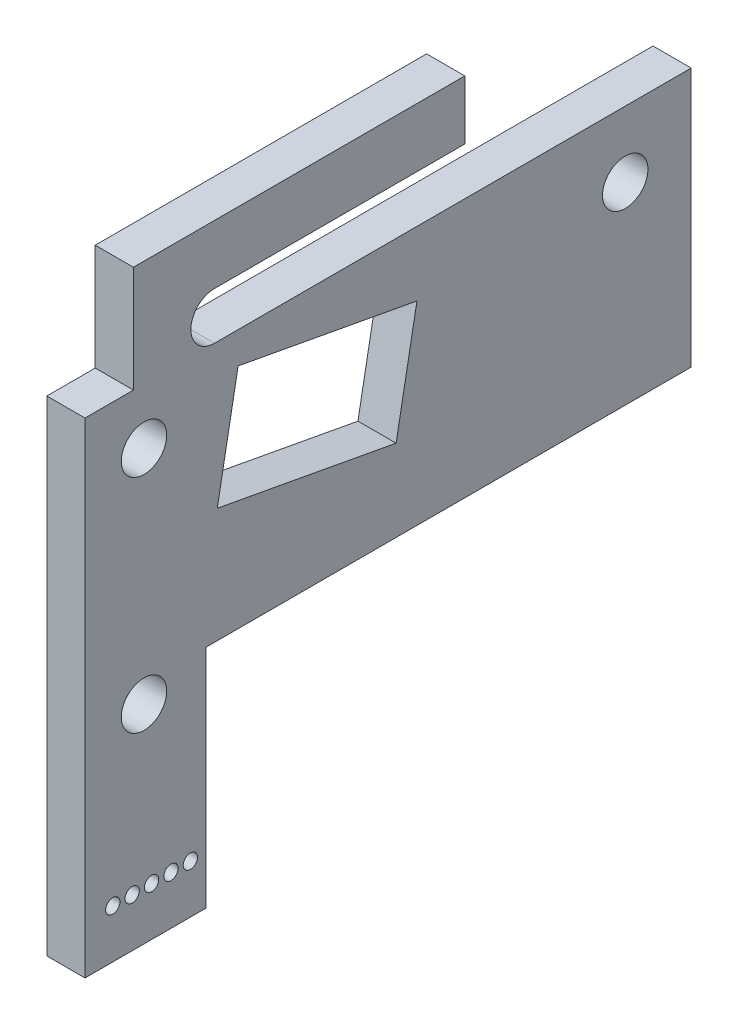
from build123d import *

# Parameters (mm, degrees)
SKETCH1_R           = 2.38125
SKETCH1_R_2         = 0.75
BOSS_EXTRUDE1_DEPTH = 2


with BuildPart() as part:
    # Sketch1 → Boss-Extrude1 (new, symmetric)
    with BuildSketch(Plane(origin=(0, 0, 0), x_dir=(0, 0, -1), z_dir=(1, 0, 0))):
        with BuildLine():
            Line((-56.590412722, 6.909587278), (-51.518608779, 6.909587278))
            Line((-51.518608779, 6.909587278), (-51.518608779, 18.053715602))
            Line((-51.518608779, 18.053715602), (-16.803992093, 18.053715602))
            Line((-16.803992093, 18.053715602), (-16.803992093, 11.873086261))
            Line((-16.803992093, 11.873086261), (-43.018227019, 11.873086261))
            ThreePointArc((-43.018227019, 11.873086261), (-45.49997651, 9.391336769), (-43.018227019, 6.909587278))
            Line((-43.018227019, 6.909587278), (6.909587278, 6.909587278))
            Line((6.909587278, 6.909587278), (6.909587278, -20.222057583))
            Line((6.909587278, -20.222057583), (-43.890412722, -20.222057583))
            Line((-43.890412722, -20.222057583), (-43.890412722, -43.890412722))
            Line((-43.890412722, -43.890412722), (-56.590412722, -43.890412722))
            Line((-56.590412722, -43.890412722), (-56.590412722, 6.909587278))
        make_face()
        Circle(SKETCH1_R, mode=Mode.SUBTRACT)
        with Locations((-45.552958224, -38.810412722)):
            Circle(SKETCH1_R_2, mode=Mode.SUBTRACT)
        with Locations((-47.584958224, -38.810412722)):
            Circle(SKETCH1_R_2, mode=Mode.SUBTRACT)
        with Locations((-49.616958224, -38.810412722)):
            Circle(SKETCH1_R_2, mode=Mode.SUBTRACT)
        with Locations((-51.648958224, -38.810412722)):
            Circle(SKETCH1_R_2, mode=Mode.SUBTRACT)
        with Locations((-50.410128911, -22.137211246)):
            Circle(SKETCH1_R, mode=Mode.SUBTRACT)
        with Locations((-50.410128911, 1.079375692)):
            Circle(SKETCH1_R, mode=Mode.SUBTRACT)
        with Locations((-53.680958224, -38.810412722)):
            Circle(SKETCH1_R_2, mode=Mode.SUBTRACT)
        Polygon((-40.547855017, 3.612408172), (-21.81561352, 0.147494252), (-24.001169646, -11.668200482), (-42.733411143, -8.203286562), align=None, mode=Mode.SUBTRACT)
    extrude(amount=BOSS_EXTRUDE1_DEPTH, both=True)


solid = part.part
